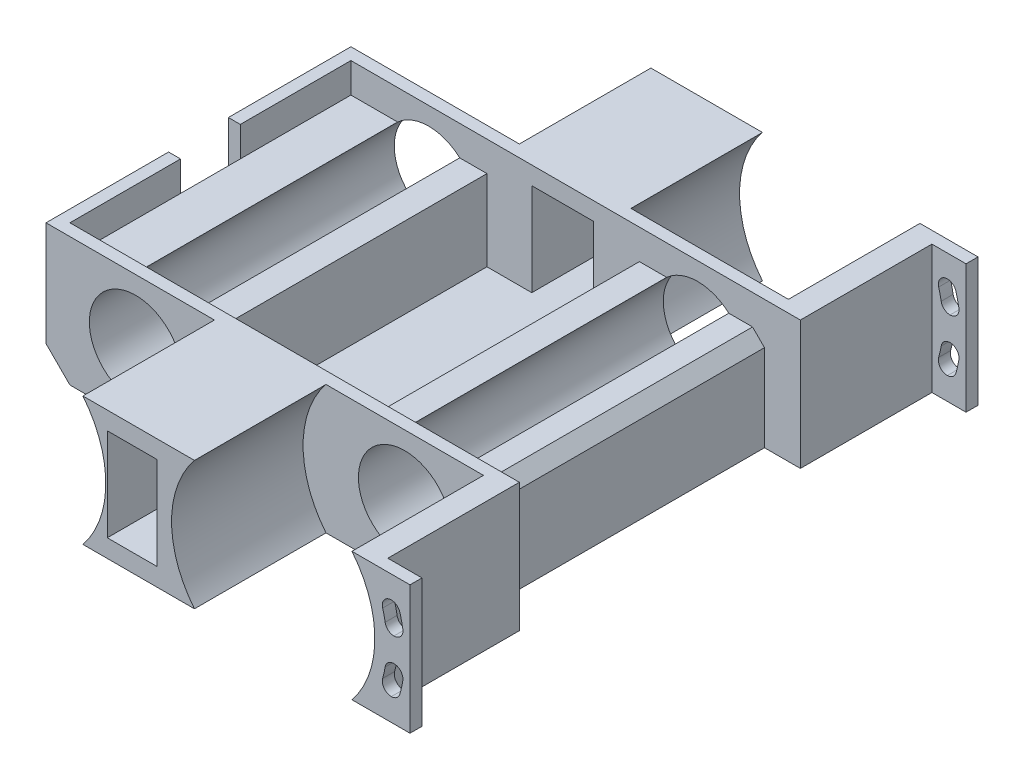
from build123d import *

# Parameters (mm, degrees)
SKETCH1_W           = 95
SKETCH1_H           = 95
BOSS_EXTRUDE1_DEPTH = 25
SKETCH2_R           = 7.75
CUT_EXTRUDE2_DEPTH  = 100
SKETCH3_R           = 17
CUT_EXTRUDE3_DEPTH  = 22
CUT_EXTRUDE4_START  = -22
SKETCH4_R           = 17
CUT_EXTRUDE4_DEPTH  = 22
SKETCH5_W           = 6.246993927
SKETCH5_H           = 25
CUT_EXTRUDE5_DEPTH  = 22
SKETCH6_W           = 7.178723585
SKETCH6_H           = 25
CUT_EXTRUDE6_DEPTH  = 22
SKETCH8_W           = 99.503929421
SKETCH8_H           = 3.5
CUT_EXTRUDE7_DEPTH  = 100
SKETCH9_W           = 8.3
SKETCH9_H           = 15.5
CUT_EXTRUDE11_DEPTH = 100
SKETCH13_W          = 87
SKETCH13_H          = 15.5
CUT_EXTRUDE12_DEPTH = 2
SKETCH14_W          = 25.5
SKETCH14_H          = 47
CUT_EXTRUDE14_DEPTH = 18.5
SKETCH16_W          = 24.75
SKETCH16_H          = 47
CUT_EXTRUDE15_DEPTH = 5
SKETCH17_W          = 20.919567191
SKETCH17_H          = 47
CUT_EXTRUDE16_DEPTH = 5
CUT_EXTRUDE17_DEPTH = 100
FILLET6_R           = 1.5
FILLET7_R           = 1.5
FILLET8_R           = 1.5
FILLET9_R           = 1.5
SKETCH19_W          = 12.12120401
SKETCH19_H          = 21.5
CUT_EXTRUDE20_DEPTH = 100
SKETCH20_W          = 5.709228799
SKETCH20_H          = 91
CUT_EXTRUDE23_DEPTH = 100
SKETCH21_W          = 6
SKETCH21_H          = 47
CUT_EXTRUDE26_DEPTH = 40
CHAMFER1_SIZE       = 2
SKETCH22_W          = 15
SKETCH22_H          = 10
CUT_EXTRUDE27_DEPTH = 4
SKETCH23_W          = 2
SKETCH23_H          = 10
CUT_EXTRUDE28_DEPTH = 54
CHAMFER2_SIZE       = 2
CHAMFER3_SIZE       = 4
CHAMFER4_SIZE       = 4


with BuildPart() as part:
    # Sketch1 → Boss-Extrude1 (new body)
    with BuildSketch(Plane(origin=(0, 0, 0), x_dir=(1, 0, 0), z_dir=(0, 1, 0))):
        with Locations((3.271948822, -17.506298191)):
            Rectangle(SKETCH1_W, SKETCH1_H)
    extrude(amount=BOSS_EXTRUDE1_DEPTH)

    # Sketch2 → Cut-Extrude2 (cut)
    with BuildSketch(Plane.XY.offset(65.006298191)):
        with Locations((-29.228051178, 10.75)):
            Circle(SKETCH2_R)
        with Locations((15.771948822, 10.75)):
            Circle(SKETCH2_R)
    extrude(amount=-CUT_EXTRUDE2_DEPTH, mode=Mode.SUBTRACT)

    # Sketch3 → Cut-Extrude3 (cut)
    with BuildSketch(Plane.XY.offset(65.006298191)):
        with Locations((-29.228051178, 10.75)):
            Circle(SKETCH3_R)
        with Locations((15.771948822, 10.75)):
            Circle(SKETCH3_R)
    extrude(amount=-CUT_EXTRUDE3_DEPTH, mode=Mode.SUBTRACT)

    # Sketch4 → Cut-Extrude4 (cut)
    with BuildSketch(Plane(origin=(0, 0, -29.993701809), x_dir=(-1, 0, 0), z_dir=(0, 0, -1)).offset(CUT_EXTRUDE4_START)):
        with Locations((-15.771948822, 10.75)):
            Circle(SKETCH4_R)
        with Locations((29.228051178, 10.75)):
            Circle(SKETCH4_R)
    extrude(amount=CUT_EXTRUDE4_DEPTH, mode=Mode.SUBTRACT)

    # Sketch5 → Cut-Extrude5 (cut)
    with BuildSketch(Plane.XY.offset(65.006298191)):
        with Locations((-41.104554214, 12.5)):
            Rectangle(SKETCH5_W, SKETCH5_H)
    extrude(amount=-CUT_EXTRUDE5_DEPTH, mode=Mode.SUBTRACT)

    # Sketch6 → Cut-Extrude6 (cut)
    with BuildSketch(Plane(origin=(0, 0, -29.993701809), x_dir=(-1, 0, 0), z_dir=(0, 0, -1))):
        with Locations((40.638689386, 12.5)):
            Rectangle(SKETCH6_W, SKETCH6_H)
    extrude(amount=-CUT_EXTRUDE6_DEPTH, mode=Mode.SUBTRACT)

    # Sketch8 → Cut-Extrude7 (cut)
    with BuildSketch(Plane(origin=(0, 0, -29.993701809), x_dir=(-1, 0, 0), z_dir=(0, 0, -1))):
        with Locations((-1.019984112, 23.25)):
            Rectangle(SKETCH8_W, SKETCH8_H)
    extrude(amount=-CUT_EXTRUDE7_DEPTH, mode=Mode.SUBTRACT)

    # Sketch9 → Cut-Extrude11 (cut)
    with BuildSketch(Plane.XY.offset(65.006298191)):
        with Locations((-7.828051178, 10.75)):
            Rectangle(SKETCH9_W, SKETCH9_H)
    extrude(amount=-CUT_EXTRUDE11_DEPTH, mode=Mode.SUBTRACT)

    # Sketch13 → Cut-Extrude12 (cut)
    with BuildSketch(Plane.ZY.offset(3.678051178)):
        with Locations((17.506298191, 10.75)):
            Rectangle(SKETCH13_W, SKETCH13_H)
    extrude(amount=-CUT_EXTRUDE12_DEPTH, mode=Mode.SUBTRACT)

    # Sketch14 → Cut-Extrude14 (cut)
    with BuildSketch(Plane(origin=(0, 21.5, 0), x_dir=(1, 0, 0), z_dir=(0, 1, 0))):
        with Locations((-6.728051178, -17.506298191)):
            Rectangle(SKETCH14_W, SKETCH14_H)
    extrude(amount=-CUT_EXTRUDE14_DEPTH, mode=Mode.SUBTRACT)

    # Sketch16 → Cut-Extrude15 (cut)
    with BuildSketch(Plane(origin=(0, 21.5, 0), x_dir=(1, 0, 0), z_dir=(0, 1, 0))):
        with Locations((-29.853051178, -17.506298191)):
            Rectangle(SKETCH16_W, SKETCH16_H)
    extrude(amount=-CUT_EXTRUDE15_DEPTH, mode=Mode.SUBTRACT)

    # Sketch17 → Cut-Extrude16 (cut)
    with BuildSketch(Plane(origin=(0, 21.5, 0), x_dir=(1, 0, 0), z_dir=(0, 1, 0))):
        with Locations((16.481732418, -17.506298191)):
            Rectangle(SKETCH17_W, SKETCH17_H)
    extrude(amount=-CUT_EXTRUDE16_DEPTH, mode=Mode.SUBTRACT)

    # Sketch18 → Cut-Extrude17 (cut)
    with BuildSketch(Plane.XY.offset(65.006298191)):
        with BuildLine():
            Line((34.66639245, 12.75), (37.680851122, 12.75))
            ThreePointArc((37.680851122, 12.75), (37.300376381, 15.28065192), (36.628602437, 17.75))
            Line((36.628602437, 17.75), (33.435470555, 17.75))
            ThreePointArc((33.435470555, 17.75), (34.221100776, 15.291893017), (34.66639245, 12.75))
        make_face()
        with BuildLine():
            Line((34.66639245, 8.75), (37.680851122, 8.75))
            ThreePointArc((37.680851122, 8.75), (37.300376381, 6.21934808), (36.628602437, 3.75))
            Line((36.628602437, 3.75), (33.435470555, 3.75))
            ThreePointArc((33.435470555, 3.75), (34.221100776, 6.208106983), (34.66639245, 8.75))
        make_face()
    extrude(amount=-CUT_EXTRUDE17_DEPTH, mode=Mode.SUBTRACT)

    # Fillet6
    fillet6_edges = [part.edges().sort_by_distance(p)[0] for p in [
        (33.435470555, 17.75, 17.506298191),
        (36.628602437, 17.75, 17.506298191),
    ]]
    fillet(fillet6_edges, radius=FILLET6_R - 0.0001)  # a hair under: the kernel refuses the full size

    # Fillet7
    fillet7_edges = [part.edges().sort_by_distance(p)[0] for p in [
        (37.680851122, 12.75, 17.506298191),
        (34.66639245, 12.75, 17.506298191),
    ]]
    fillet(fillet7_edges, radius=FILLET7_R - 0.0001)  # a hair under: the kernel refuses the full size

    # Fillet8
    fillet8_edges = [part.edges().sort_by_distance(p)[0] for p in [
        (33.435470555, 3.75, 17.506298191),
        (36.628602437, 3.75, 17.506298191),
    ]]
    fillet(fillet8_edges, radius=FILLET8_R - 0.0001)  # a hair under: the kernel refuses the full size

    # Fillet9
    fillet9_edges = [part.edges().sort_by_distance(p)[0] for p in [
        (37.680851122, 8.75, 17.506298191),
        (34.66639245, 8.75, 17.506298191),
    ]]
    fillet(fillet9_edges, radius=FILLET9_R - 0.0001)  # a hair under: the kernel refuses the full size

    # Sketch19 → Cut-Extrude20 (cut)
    with BuildSketch(Plane.XY.offset(65.006298191)):
        with Locations((44.711346817, 10.75)):
            Rectangle(SKETCH19_W, SKETCH19_H)
    extrude(amount=-CUT_EXTRUDE20_DEPTH, mode=Mode.SUBTRACT)

    # Sketch20 → Cut-Extrude23 (cut)
    with BuildSketch(Plane(origin=(0, 21.5, 0), x_dir=(1, 0, 0), z_dir=(0, 1, 0))):
        with Locations((35.796130413, -17.506298191)):
            Rectangle(SKETCH20_W, SKETCH20_H)
    extrude(amount=-CUT_EXTRUDE23_DEPTH, mode=Mode.SUBTRACT)

    # Sketch21 → Cut-Extrude26 (cut)
    with BuildSketch(Plane(origin=(0, 21.5, 0), x_dir=(1, 0, 0), z_dir=(0, 1, 0))):
        with Locations((29.941516013, -17.506298191)):
            Rectangle(SKETCH21_W, SKETCH21_H)
    extrude(amount=-CUT_EXTRUDE26_DEPTH, mode=Mode.SUBTRACT)

    # Chamfer1
    chamfer1_edges = [part.edges().sort_by_distance(p)[0] for p in [
        (26.941516013, 16.5, 17.506298191),
    ]]
    chamfer(chamfer1_edges, length=CHAMFER1_SIZE)

    # Sketch22 → Cut-Extrude27 (cut)
    with BuildSketch(Plane(origin=(0, 0, 0), x_dir=(-1, 0, 0), z_dir=(0, -1, 0))):
        with Locations((34.728051178, -17.506298191)):
            Rectangle(SKETCH22_W, SKETCH22_H)
    extrude(amount=-CUT_EXTRUDE27_DEPTH, mode=Mode.SUBTRACT)

    # Sketch23 → Cut-Extrude28 (cut)
    with BuildSketch(Plane(origin=(0, 0, 0), x_dir=(-1, 0, 0), z_dir=(0, -1, 0))):
        with Locations((43.228051178, -17.506298191)):
            Rectangle(SKETCH23_W, SKETCH23_H)
    extrude(amount=-CUT_EXTRUDE28_DEPTH, mode=Mode.SUBTRACT)

    # Chamfer2
    chamfer2_edges = [part.edges().sort_by_distance(p)[0] for p in [
        (-42.228051178, 4, 17.506298191),
    ]]
    chamfer(chamfer2_edges, length=CHAMFER2_SIZE)

    # Chamfer3
    chamfer3_edges = [part.edges().sort_by_distance(p)[0] for p in [
        (-44.228051178, 0, 2.256298191),
    ]]
    chamfer(chamfer3_edges, length=CHAMFER3_SIZE)

    # Chamfer4
    chamfer4_edges = [part.edges().sort_by_distance(p)[0] for p in [
        (-44.228051178, 0, 32.756298191),
    ]]
    chamfer(chamfer4_edges, length=CHAMFER4_SIZE)


solid = part.part
